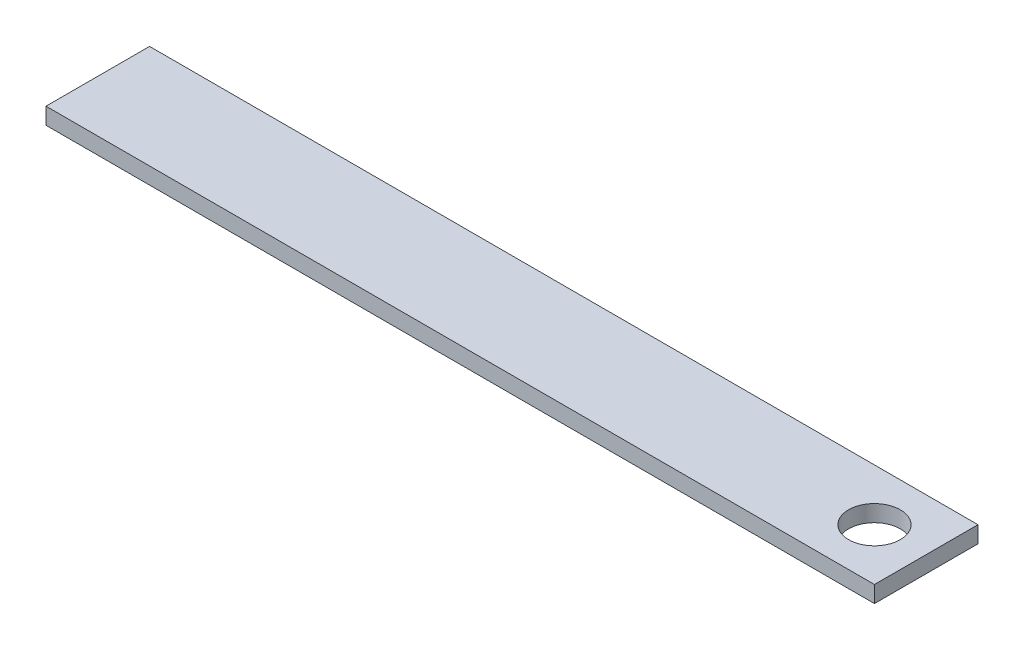
from build123d import *

# Parameters (mm, degrees)
SKETCH1_W           = 200
SKETCH1_H           = 25
SKETCH1_R           = 6.25
BOSS_EXTRUDE1_DEPTH = 4


with BuildPart() as part:
    # Sketch1 → Boss-Extrude1 (new body)
    with BuildSketch(Plane(origin=(0, 0, 0), x_dir=(1, 0, 0), z_dir=(0, 1, 0))):
        Rectangle(SKETCH1_W, SKETCH1_H)
        with Locations((87.5, 0)):
            Circle(SKETCH1_R, mode=Mode.SUBTRACT)
    extrude(amount=BOSS_EXTRUDE1_DEPTH)


solid = part.part
